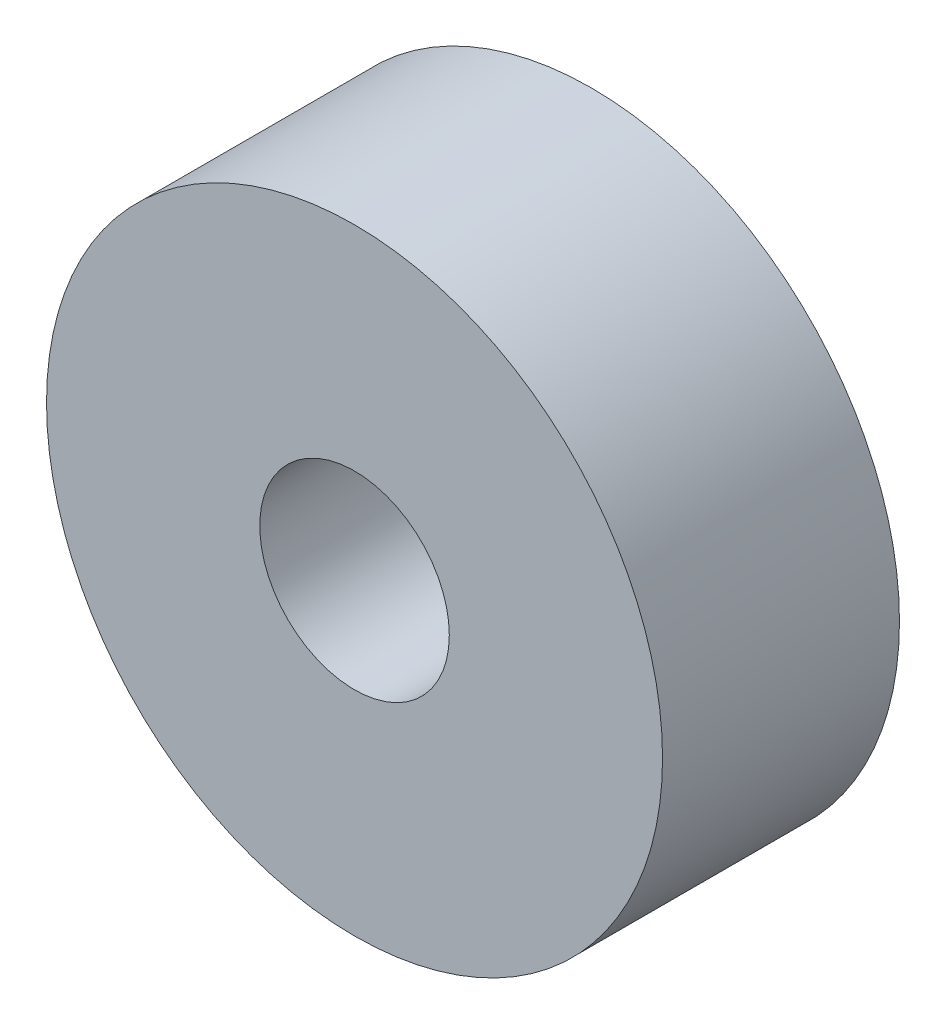
from build123d import *

# Parameters (mm, degrees)
SKETCH1_R           = 6.5
SKETCH1_R_2         = 2
BOSS_EXTRUDE1_DEPTH = 2.5


with BuildPart() as part:
    # Sketch1 → Boss-Extrude1 (new, symmetric)
    with BuildSketch(Plane.XY):
        Circle(SKETCH1_R)
        Circle(SKETCH1_R_2, mode=Mode.SUBTRACT)
    extrude(amount=BOSS_EXTRUDE1_DEPTH, both=True)


solid = part.part
